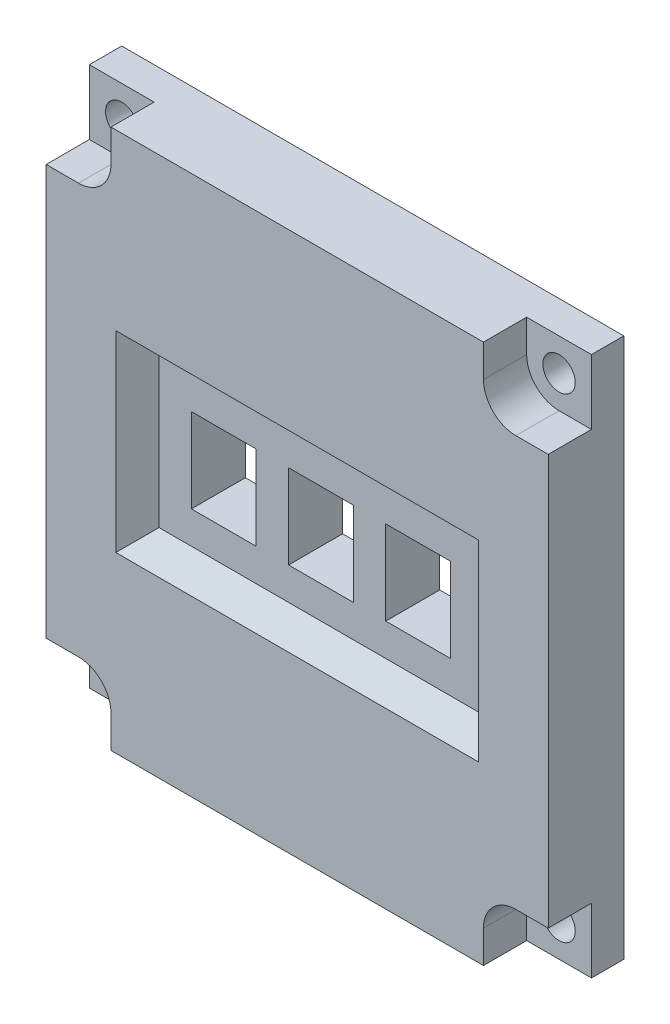
from build123d import *

# Parameters (mm, degrees)
SKETCH1_W           = 46.5
SKETCH1_H           = 50
BOSS_EXTRUDE1_DEPTH = 7
SKETCH2_W           = 33.6
SKETCH2_H           = 17.8
CUT_EXTRUDE1_DEPTH  = 2
CHAMFER1_SIZE       = 2
CUT_EXTRUDE2_DEPTH  = 4
SKETCH4_R           = 1.5
CUT_EXTRUDE3_DEPTH  = 10
SKETCH5_W           = 6
SKETCH5_H           = 7.8
CUT_EXTRUDE4_DEPTH  = 10


with BuildPart() as part:
    # Sketch1 → Boss-Extrude1 (new body)
    with BuildSketch(Plane.XY):
        Rectangle(SKETCH1_W, SKETCH1_H)
    extrude(amount=BOSS_EXTRUDE1_DEPTH)

    # Sketch2 → Cut-Extrude1 (cut)
    with BuildSketch(Plane.XY.offset(7)):
        Rectangle(SKETCH2_W, SKETCH2_H)
    extrude(amount=-CUT_EXTRUDE1_DEPTH, mode=Mode.SUBTRACT)

    # Chamfer1
    chamfer1_edges = [part.edges().sort_by_distance(p)[0] for p in [
        (0, -8.9, 5),
        (16.8, 0, 5),
        (0, 8.9, 5),
        (-16.8, 0, 5),
    ]]
    chamfer(chamfer1_edges, length=CHAMFER1_SIZE - 0.0001)  # a hair under: the kernel refuses the full size

    # Sketch3 → Cut-Extrude2 (cut)
    with BuildSketch(Plane.XY.offset(7)):
        with BuildLine():
            Line((23.25, -25), (17.25, -25))
            Line((17.25, -25), (17.25, -22))
            ThreePointArc((17.25, -22), (18.128679656, -19.878679656), (20.25, -19))
            Line((20.25, -19), (23.25, -19))
            Line((23.25, -19), (23.25, -25))
        make_face()
        with BuildLine():
            Line((-23.25, -25), (-17.25, -25))
            Line((-17.25, -25), (-17.25, -22))
            ThreePointArc((-17.25, -22), (-18.128679656, -19.878679656), (-20.25, -19))
            Line((-20.25, -19), (-23.25, -19))
            Line((-23.25, -19), (-23.25, -25))
        make_face()
        with BuildLine():
            Line((-17.25, 25), (-17.25, 22))
            ThreePointArc((-17.25, 22), (-18.128679656, 19.878679656), (-20.25, 19))
            Line((-20.25, 19), (-23.25, 19))
            Line((-23.25, 19), (-23.25, 25))
            Line((-23.25, 25), (-17.25, 25))
        make_face()
        with BuildLine():
            Line((17.25, 25), (17.25, 22))
            ThreePointArc((17.25, 22), (18.128679656, 19.878679656), (20.25, 19))
            Line((20.25, 19), (23.25, 19))
            Line((23.25, 19), (23.25, 25))
            Line((23.25, 25), (17.25, 25))
        make_face()
    extrude(amount=-CUT_EXTRUDE2_DEPTH, mode=Mode.SUBTRACT)

    # Sketch4 → Cut-Extrude3 (cut)
    with BuildSketch(Plane.XY.offset(7)):
        with Locations((-20.25, 22)):
            Circle(SKETCH4_R)
        with Locations((20.25, 22)):
            Circle(SKETCH4_R)
        with Locations((20.25, -22)):
            Circle(SKETCH4_R)
        with Locations((-20.25, -22)):
            Circle(SKETCH4_R)
    extrude(amount=-CUT_EXTRUDE3_DEPTH, mode=Mode.SUBTRACT)

    # Sketch5 → Cut-Extrude4 (cut)
    with BuildSketch(Plane.XY.offset(5)):
        with Locations((-8.8, 0)):
            Rectangle(SKETCH5_W, SKETCH5_H)
        with Locations((0.2, 0)):
            Rectangle(SKETCH5_W, SKETCH5_H)
        with Locations((9.2, 0)):
            Rectangle(SKETCH5_W, SKETCH5_H)
    extrude(amount=-CUT_EXTRUDE4_DEPTH, mode=Mode.SUBTRACT)


solid = part.part
